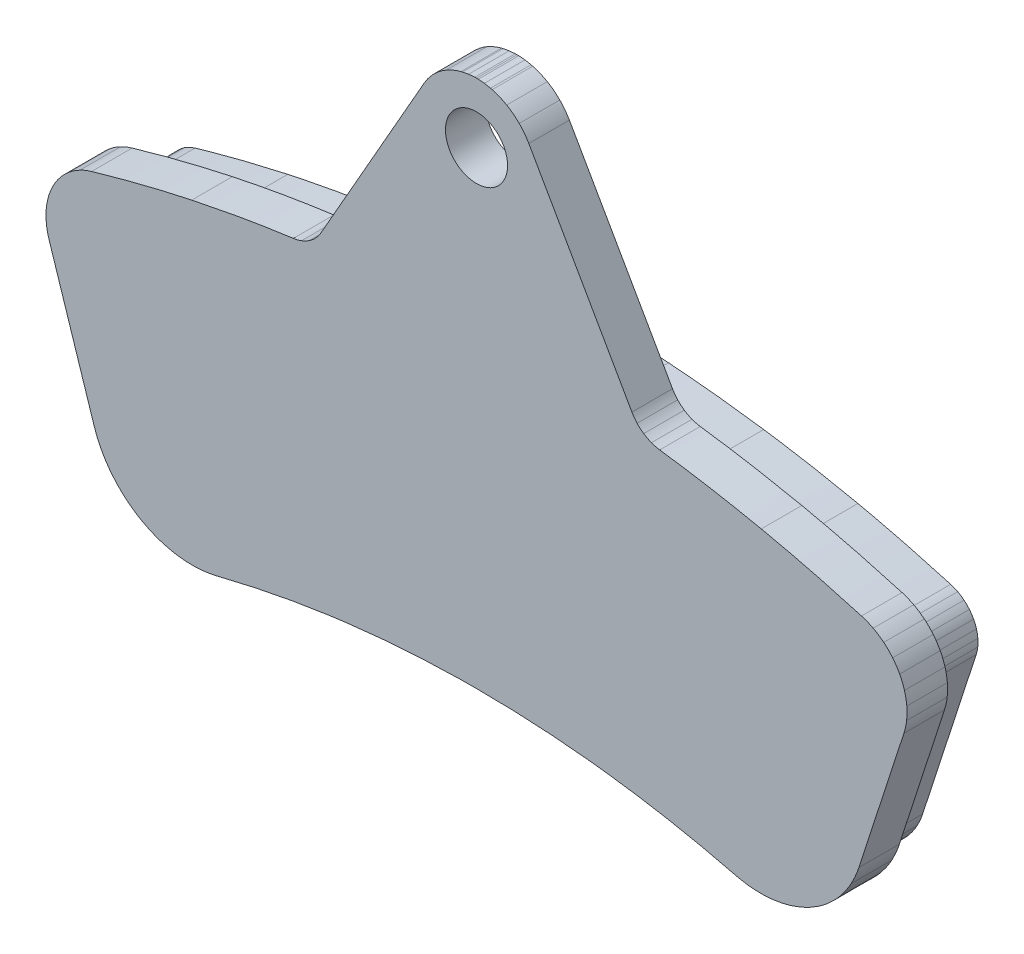
from build123d import *

# Parameters (mm, degrees)
SKETCH1_R       = 2.450000003
PAD_MOUNT_DEPTH = 3.2004
PAD_DEPTH       = 4.39928


# Read off the part's stored shape, not the designer's step: Surface-Imported1
with BuildPart() as part:
    # Sketch1 → Pad Mount (new body)
    with BuildSketch(Plane.XY):
        with BuildLine():
            Line((12.25936605, -11.934212392), (4.128007879, 2.34990451))
            add(Edge.make_bspline(
                [(4.128007879, 2.34990451), (3.999340352, 2.574099785), (3.867066243, 2.758693855), (3.769843289, 2.894372567), (3.652326571, 3.037042058), (3.593097298, 3.108948509), (3.480614764, 3.231703476), (3.404855291, 3.314381659), (3.373949892, 3.343280933)],
                knots=[0, 0, 0, 0.25, 0.25, 0.5, 0.5, 0.75, 0.75, 1, 1, 1], degree=2))
            add(Edge.make_bspline(
                [(3.373949892, 3.343280933), (3.191488806, 3.52628179), (3.015799694, 3.670091127), (2.886629827, 3.775822397), (2.736010579, 3.88301786), (2.660082133, 3.937056006), (2.519546357, 4.026281686), (2.424826493, 4.086419001), (2.387461943, 4.106270388)],
                knots=[0, 0, 0, 0.25, 0.25, 0.5, 0.5, 0.75, 0.75, 1, 1, 1], degree=2))
            add(Edge.make_bspline(
                [(2.387461943, 4.106270388), (2.163623297, 4.23545869), (1.956539516, 4.328575304), (1.804297969, 4.397031739), (1.630975245, 4.461321335), (1.543604269, 4.493729345), (1.384680302, 4.543303417), (1.277585639, 4.576710074), (1.236341357, 4.586153551)],
                knots=[0, 0, 0, 0.25, 0.25, 0.5, 0.5, 0.75, 0.75, 1, 1, 1], degree=2))
            ThreePointArc((1.236341357, 4.586153551), (1.170341889, 4.603302607), (1.104136768, 4.619639742))
            add(Edge.make_bspline(
                [(1.104136768, 4.619639742), (1.095584239, 4.621613503), (1.086562435, 4.623671516), (0.924257625, 4.660695763), (0.832434712, 4.676594864), (0.725207991, 4.695161129), (0.623571318, 4.70880675)],
                knots=[0.35283416, 0.35283416, 0.35283416, 0.373455028, 0.373455028, 0.623455028, 0.623455028, 0.770620868, 0.770620868, 0.770620868], degree=2))
            add(Edge.make_bspline(
                [(0.623571318, 4.70880675), (0.521887144, 4.722086545), (0.413524712, 4.732070465), (0.320728996, 4.740620152), (0.154381691, 4.747118918), (0.14513468, 4.747480175), (0.13636275, 4.747800627)],
                knots=[0.352835881, 0.352835881, 0.352835881, 0.5, 0.5, 0.75, 0.75, 0.770621972, 0.770621972, 0.770621972], degree=2))
            ThreePointArc((0.13636275, 4.747800627), (0.068187762, 4.749259353), (1e-09, 4.749880644))
            ThreePointArc((1e-09, 4.749880644), (-0.068187939, 4.749259351), (-0.136363104, 4.747800615))
            add(Edge.make_bspline(
                [(-0.136363104, 4.747800615), (-0.145134917, 4.747480166), (-0.154381691, 4.747118918), (-0.320728996, 4.740620152), (-0.413524712, 4.732070465), (-0.521889791, 4.722086301), (-0.623576284, 4.708806093)],
                knots=[0.352832286, 0.352832286, 0.352832286, 0.373453842, 0.373453842, 0.623453842, 0.623453842, 0.770621556, 0.770621556, 0.770621556], degree=2))
            add(Edge.make_bspline(
                [(-0.623576284, 4.708806093), (-0.72521061, 4.695160675), (-0.832434712, 4.676594864), (-0.924257625, 4.660695763), (-1.086562435, 4.623671516), (-1.095584388, 4.621613468), (-1.104137051, 4.619639676)],
                knots=[0.352837755, 0.352837755, 0.352837755, 0.5, 0.5, 0.75, 0.75, 0.77062121, 0.77062121, 0.77062121], degree=2))
            ThreePointArc((-1.104137051, 4.619639676), (-1.17034203, 4.603302572), (-1.236341357, 4.586153551))
            add(Edge.make_bspline(
                [(-1.236341357, 4.586153551), (-1.277585639, 4.576710074), (-1.384680302, 4.543303417), (-1.543604269, 4.493729345), (-1.630975245, 4.461321335), (-1.804297969, 4.397031739), (-1.956539516, 4.328575304), (-2.163623297, 4.23545869), (-2.387461943, 4.106270388)],
                knots=[0, 0, 0, 0.25, 0.25, 0.5, 0.5, 0.75, 0.75, 1, 1, 1], degree=2))
            add(Edge.make_bspline(
                [(-2.387461943, 4.106270388), (-2.424826493, 4.086419001), (-2.519546357, 4.026281686), (-2.660082133, 3.937056006), (-2.736010579, 3.88301786), (-2.886629827, 3.775822397), (-3.015799694, 3.670091127), (-3.191488806, 3.52628179), (-3.373949892, 3.343280933)],
                knots=[0, 0, 0, 0.25, 0.25, 0.5, 0.5, 0.75, 0.75, 1, 1, 1], degree=2))
            add(Edge.make_bspline(
                [(-3.373949892, 3.343280933), (-3.404855291, 3.314381659), (-3.480614764, 3.231703476), (-3.593097298, 3.108948509), (-3.652326571, 3.037042058), (-3.769843289, 2.894372567), (-3.867066243, 2.758693855), (-3.999340352, 2.574099785), (-4.128007879, 2.34990451)],
                knots=[0, 0, 0, 0.25, 0.25, 0.5, 0.5, 0.75, 0.75, 1, 1, 1], degree=2))
            Line((-4.128007879, 2.34990451), (-12.25936605, -11.934212392))
            add(Edge.make_bspline(
                [(-12.25936605, -11.934212392), (-12.271321337, -11.960179359), (-12.361174649, -12.099380332), (-12.406249196, -12.169209931), (-12.451105068, -12.229686447), (-12.561130043, -12.378026602), (-12.665840232, -12.488926906)],
                knots=[0, 0, 0, 0.5, 0.5, 0.714285714, 0.714285714, 1, 1, 1], degree=2))
            add(Edge.make_bspline(
                [(-12.665840232, -12.488926906), (-12.683394704, -12.511489174), (-12.802586447, -12.626571259), (-12.862378443, -12.684301662), (-12.919827679, -12.732974592), (-13.060742155, -12.852362087), (-13.18795556, -12.936503732)],
                knots=[0, 0, 0, 0.5, 0.5, 0.714285714, 0.714285714, 1, 1, 1], degree=2))
            add(Edge.make_bspline(
                [(-13.18795556, -12.936503732), (-13.210186677, -12.954475623), (-13.352453428, -13.039391407), (-13.423820972, -13.081989068), (-13.490844618, -13.116300669), (-13.655243988, -13.200462093), (-13.798276061, -13.253423727)],
                knots=[0, 0, 0, 0.5, 0.5, 0.714285714, 0.714285714, 1, 1, 1], degree=2))
            add(Edge.make_bspline(
                [(-13.798276061, -13.253423727), (-13.822956068, -13.265356768), (-13.977800116, -13.314849615), (-14.056049838, -13.339860595), (-14.125912582, -13.357468513), (-14.302341812, -13.401935009), (-14.44957275, -13.420858544)],
                knots=[-6.75e-07, -6.75e-07, -6.75e-07, 0.499999325, 0.499999325, 0.714285039, 0.714285039, 1, 1, 1], degree=2))
            add(Edge.make_bspline(
                [(-14.44957275, -13.420858544), (-14.454612733, -13.420009478), (-14.46009159, -13.422076708), (-14.470596867, -13.423456967), (-14.475850695, -13.424160231), (-14.491601891, -13.426281129), (-14.502099942, -13.427713047), (-14.533592635, -13.432026256), (-14.554584197, -13.434927215), (-14.617555669, -13.443654624), (-14.659531605, -13.449508945), (-14.785454675, -13.467106572), (-14.869398903, -13.478885246), (-15.037280682, -13.502460443), (-15.121220279, -13.51426787), (-15.247118291, -13.532043878), (-15.289384, -13.538022813), (-15.352326357, -13.546957784), (-15.37218359, -13.549781459), (-15.414141523, -13.555763676), (-15.437717081, -13.559134281), (-15.461314769, -13.562524777), (-15.463170105, -13.5627915), (-15.467102959, -13.563357241), (-15.467781255, -13.563454842), (-15.469747658, -13.563737875), (-15.470070703, -13.56378438), (-15.471381631, -13.563973123), (-15.47668036, -13.564736217), (-15.478646731, -13.565019477), (-15.488783212, -13.566480398), (-15.491404986, -13.566858451), (-15.500938679, -13.568233846), (-15.503560401, -13.568612255), (-15.512505619, -13.569903958), (-15.515127293, -13.570282703), (-15.523498451, -13.571492582), (-15.526120078, -13.571871647), (-15.53393169, -13.573001602), (-15.536553274, -13.57338097), (-15.543819945, -13.574432933), (-15.546441487, -13.574812587), (-15.553177912, -13.57578852), (-15.555799415, -13.576168445), (-15.562020369, -13.577070337), (-15.565952568, -13.577640608), (-15.576907558, -13.579230364), (-15.582150355, -13.57999166), (-15.591222652, -13.581309757), (-15.596465329, -13.582071876), (-15.60377567, -13.58313508), (-15.609018243, -13.583897919), (-15.614688278, -13.584723303), (-15.622552, -13.585868498), (-15.62946159, -13.586875412), (-15.639946263, -13.588404325), (-15.641772145, -13.588670706), (-15.649635496, -13.589818443), (-15.648952713, -13.589718767), (-15.65419491, -13.590484184), (-15.652614733, -13.590253429), (-15.657856899, -13.591019054), (-15.655504478, -13.590675442), (-15.66074662, -13.591441231), (-15.6577473, -13.591003044), (-15.662989423, -13.59176896), (-15.659468694, -13.59125452), (-15.664710803, -13.592020534), (-15.660794257, -13.591448192), (-15.666036355, -13.592214281), (-15.661849656, -13.591602405), (-15.667091745, -13.592368555), (-15.662760604, -13.591735522), (-15.668002686, -13.592501723), (-15.663652848, -13.591865914), (-15.668894922, -13.592632165), (-15.664652158, -13.592011963), (-15.669894225, -13.592778271), (-15.665884338, -13.592192061), (-15.671126393, -13.592958439), (-15.667475228, -13.592424614), (-15.672717271, -13.593191082), (-15.669550734, -13.592728049), (-15.67479276, -13.593494635), (-15.672234402, -13.593120467), (-15.677476406, -13.593887205), (-15.675578556, -13.593609575), (-15.680820532, -13.594376502), (-15.679554783, -13.594191289), (-15.687417698, -13.595342017), (-15.686651652, -13.595229866), (-15.697135377, -13.596765269), (-15.69850539, -13.596966005), (-15.708988919, -13.598502744), (-15.712233619, -13.598978617), (-15.727958572, -13.601286043), (-15.739025421, -13.602911897), (-15.759990971, -13.605995649), (-15.775411129, -13.608266802), (-15.796375484, -13.611358664), (-15.814037245, -13.613967145), (-15.835000336, -13.617067562), (-15.852775302, -13.619700161), (-15.873737131, -13.622809102), (-15.889570345, -13.625160509), (-15.910530979, -13.628277495), (-15.923795128, -13.630252375), (-15.944754655, -13.633376799), (-15.955970979, -13.635050718), (-16.0083672, -13.642879166), (-16.043973796, -13.648221486), (-16.106837788, -13.657692098), (-16.126102957, -13.660600522), (-16.168008401, -13.666939991), (-16.189247755, -13.670159936), (-16.252099944, -13.679708568), (-16.295725529, -13.686364358), (-16.37951251, -13.699200332), (-16.421193986, -13.705611761), (-16.546851203, -13.725016912), (-16.630518229, -13.738039715), (-16.756129715, -13.757738714), (-16.796935554, -13.764161866), (-16.880661696, -13.777388869), (-16.924398911, -13.784324044), (-17.008110035, -13.797645758), (-17.053100263, -13.80483155), (-17.11587237, -13.814893187), (-17.133347588, -13.81769885), (-17.175192237, -13.824427926), (-17.201848119, -13.82872311), (-17.243688447, -13.835479), (-17.265191593, -13.83895766), (-17.307027882, -13.845738513), (-17.324891978, -13.848639094), (-17.366724446, -13.855443484), (-17.383956549, -13.85825135), (-17.425785221, -13.865079036), (-17.444842069, -13.868195299), (-17.549403928, -13.885324572), (-17.635217359, -13.899487743), (-17.802450339, -13.927294431), (-17.885465604, -13.941198764), (-18.13621559, -13.983502763), (-18.303541222, -14.012141441), (-18.554086942, -14.055638865), (-18.637030306, -14.070140342), (-18.762251048, -14.092187147), (-18.80382421, -14.099532213), (-18.887287118, -14.114329625), (-18.931375389, -14.122173854), (-19.014820218, -14.137072876), (-19.056979102, -14.144626417), (-19.109120907, -14.154000892), (-19.118261767, -14.155645663), (-19.133903501, -14.158462492), (-19.138312085, -14.159256728), (-19.14873964, -14.161136099), (-19.155834989, -14.162415553), (-19.181903043, -14.167118606), (-19.207833767, -14.171806045), (-19.249537507, -14.179359404), (-19.272182892, -14.183468498), (-19.313881742, -14.191048798), (-19.334094781, -14.194729736), (-19.396636013, -14.20613887), (-19.433207153, -14.212832991), (-19.516577304, -14.228144369), (-19.55368801, -14.234982775), (-19.63703998, -14.250392822), (-19.67778132, -14.257950619), (-19.802781272, -14.281216643), (-19.888698828, -14.297317056), (-20.138585303, -14.344454443), (-20.30472939, -14.37620318), (-21.136944467, -14.537200406), (-21.801865173, -14.672127069), (-22.465204102, -14.81216957)],
                knots=[0, 0, 0, 0, 1.5893e-05, 1.5893e-05, 3.1787e-05, 3.1787e-05, 6.3573e-05, 6.3573e-05, 0.000127147, 0.000127147, 0.000254293, 0.000254293, 0.000508587, 0.000508587, 0.00076288, 0.00076288, 0.000890027, 0.000890027, 0.000953601, 0.000953601, 0.001017174, 0.001017174, 0.001025121, 0.001025121, 0.001029094, 0.001029094, 0.001031081, 0.001031081, 0.001033067, 0.001033067, 0.001037041, 0.001037041, 0.001041014, 0.001041014, 0.001044987, 0.001044987, 0.001048961, 0.001048961, 0.001052934, 0.001052934, 0.001056907, 0.001056907, 0.001060881, 0.001060881, 0.001064854, 0.001064854, 0.001072801, 0.001072801, 0.001080747, 0.001080747, 0.001088694, 0.001088694, 0.001096641, 0.001096641, 0.001112534, 0.001112534, 0.001128427, 0.001128427, 0.001136374, 0.001136374, 0.001144321, 0.001144321, 0.001152267, 0.001152267, 0.001160214, 0.001160214, 0.001168161, 0.001168161, 0.001176107, 0.001176107, 0.001184054, 0.001184054, 0.001192001, 0.001192001, 0.001199947, 0.001199947, 0.001207894, 0.001207894, 0.001215841, 0.001215841, 0.001223787, 0.001223787, 0.001231734, 0.001231734, 0.001239681, 0.001239681, 0.001247627, 0.001247627, 0.001255574, 0.001255574, 0.001271467, 0.001271467, 0.001287361, 0.001287361, 0.001303254, 0.001303254, 0.001335041, 0.001335041, 0.001366828, 0.001366828, 0.001398614, 0.001398614, 0.001430401, 0.001430401, 0.001462188, 0.001462188, 0.001493974, 0.001493974, 0.001525761, 0.001525761, 0.001652908, 0.001652908, 0.001716481, 0.001716481, 0.001780054, 0.001780054, 0.001907201, 0.001907201, 0.002034348, 0.002034348, 0.002288641, 0.002288641, 0.002415788, 0.002415788, 0.002542935, 0.002542935, 0.002670082, 0.002670082, 0.002733655, 0.002733655, 0.002797228, 0.002797228, 0.002860802, 0.002860802, 0.002924375, 0.002924375, 0.002987949, 0.002987949, 0.003051522, 0.003051522, 0.003305815, 0.003305815, 0.003560109, 0.003560109, 0.004068696, 0.004068696, 0.004322989, 0.004322989, 0.004450136, 0.004450136, 0.004577283, 0.004577283, 0.00470443, 0.00470443, 0.004736216, 0.004736216, 0.00475211, 0.00475211, 0.004768003, 0.004768003, 0.004831576, 0.004831576, 0.00489515, 0.00489515, 0.004958723, 0.004958723, 0.00508587, 0.00508587, 0.005213017, 0.005213017, 0.005340163, 0.005340163, 0.005594457, 0.005594457, 0.006103044, 0.006103044, 0.008137392, 0.008137392, 0.008137392, 0.008137392], degree=3))
            add(Edge.make_bspline(
                [(-22.465204102, -14.81216957), (-22.467932819, -14.81199209), (-22.801976608, -14.884791625), (-23.28899373, -14.990929267), (-23.475830393, -15.032391531), (-24.273884354, -15.209493408), (-25.14380235, -15.417678651), (-27.750005353, -16.041384574), (-30.368003375, -16.807420069)],
                knots=[0, 0, 0, 0.5, 0.5, 0.625, 0.625, 0.75, 0.75, 1, 1, 1], degree=2))
            add(Edge.make_bspline(
                [(-30.368003375, -16.807420069), (-30.395294851, -16.814617959), (-30.490293235, -16.84545993), (-30.607429645, -16.883489185), (-30.675542907, -16.908190074), (-30.986262156, -17.020870653), (-31.293206518, -17.182358994)],
                knots=[0, 0, 0, 0.25, 0.25, 0.5, 0.5, 1, 1, 1], degree=2))
            add(Edge.make_bspline(
                [(-31.293206518, -17.182358994), (-31.318524095, -17.194835155), (-31.40550191, -17.243934796), (-31.512748678, -17.304476416), (-31.57459724, -17.342216376), (-31.856738205, -17.514378644), (-32.125483347, -17.733625937)],
                knots=[0, 0, 0, 0.25, 0.25, 0.5, 0.5, 1, 1, 1], degree=2))
            add(Edge.make_bspline(
                [(-32.125483347, -17.733625937), (-32.147817787, -17.750883026), (-32.223307849, -17.816283081), (-32.316389803, -17.896923693), (-32.369508193, -17.946198294), (-32.611823829, -18.170979319), (-32.831656725, -18.439245678)],
                knots=[0, 0, 0, 0.25, 0.25, 0.5, 0.5, 1, 1, 1], degree=2))
            add(Edge.make_bspline(
                [(-32.831656725, -18.439245678), (-32.850117706, -18.460595773), (-32.911110741, -18.53968919), (-32.986317344, -18.637214213), (-33.028588095, -18.696059217), (-33.221418929, -18.964498521), (-33.383576292, -19.271089961)],
                knots=[0, 0, 0, 0.25, 0.25, 0.5, 0.5, 1, 1, 1], degree=2))
            add(Edge.make_bspline(
                [(-33.383576292, -19.271089961), (-33.397427897, -19.295681982), (-33.441492507, -19.38531582), (-33.49582575, -19.495837556), (-33.525563803, -19.561907195), (-33.661222955, -19.863303896), (-33.759240733, -20.195998759)],
                knots=[0, 0, 0, 0.25, 0.25, 0.5, 0.5, 1, 1, 1], degree=2))
            add(Edge.make_bspline(
                [(-33.759240733, -20.195998759), (-33.767930795, -20.222852381), (-33.793310448, -20.319453596), (-33.824604472, -20.438566362), (-33.840624383, -20.509226915), (-33.913704043, -20.831566369), (-33.943674854, -21.177102247)],
                knots=[0, 0, 0, 0.25, 0.25, 0.5, 0.5, 1, 1, 1], degree=2))
            add(Edge.make_bspline(
                [(-33.943674854, -21.177102247), (-33.946856957, -21.205147009), (-33.952539914, -21.304864692), (-33.959547203, -21.427820168), (-33.961210362, -21.50025484), (-33.968797367, -21.830687609), (-33.929526554, -22.175290528)],
                knots=[0, 0, 0, 0.25, 0.25, 0.5, 0.5, 1, 1, 1], degree=2))
            add(Edge.make_bspline(
                [(-33.929526554, -22.175290528), (-33.927073854, -22.203408467), (-33.912833591, -22.30226764), (-33.895274837, -22.424164548), (-33.882514945, -22.495485909), (-33.824306844, -22.820839851), (-33.717359834, -23.15077264)],
                knots=[0, 0, 0, 0.25, 0.25, 0.5, 0.5, 1, 1, 1], degree=2))
            Line((-33.717359834, -23.15077264), (-30.157868747, -34.105759847))
            add(Edge.make_bspline(
                [(-30.157868747, -34.105759847), (-30.137294808, -34.172965178), (-30.072006379, -34.35576287), (-30.00117242, -34.554087202), (-29.910375013, -34.768028674), (-29.815576212, -34.991398435), (-29.713124966, -35.198705114), (-29.650543314, -35.325337001), (-29.551214476, -35.508679211)],
                knots=[0, 0, 0, 0.25, 0.25, 0.5, 0.5, 0.75, 0.75, 1, 1, 1], degree=2))
            add(Edge.make_bspline(
                [(-29.551214476, -35.508679211), (-29.518445034, -35.570856423), (-29.42014924, -35.738234774), (-29.31350432, -35.919830041), (-29.184329381, -36.113037034), (-29.049461746, -36.314758593), (-28.910077967, -36.499270071), (-28.824936328, -36.61197766), (-28.693097928, -36.773530201)],
                knots=[0, 0, 0, 0.25, 0.25, 0.5, 0.5, 0.75, 0.75, 1, 1, 1], degree=2))
            add(Edge.make_bspline(
                [(-28.693097928, -36.773530201), (-28.649287324, -36.828489019), (-28.521446757, -36.974551904), (-28.382747578, -37.133021183), (-28.219745464, -37.29868773), (-28.049559865, -37.471655184), (-27.878153508, -37.6268718), (-27.7734511, -37.721684815), (-27.613747306, -37.85575678)],
                knots=[0, 0, 0, 0.25, 0.25, 0.5, 0.5, 0.75, 0.75, 1, 1, 1], degree=2))
            add(Edge.make_bspline(
                [(-27.613747306, -37.85575678), (-27.560438808, -37.901561221), (-27.407556822, -38.021163371), (-27.241689209, -38.150924396), (-27.050601828, -38.283214724), (-26.851093307, -38.421335031), (-26.653702437, -38.541789041), (-26.533127561, -38.615367557), (-26.351184183, -38.717236075)],
                knots=[0, 0, 0, 0.25, 0.25, 0.5, 0.5, 0.75, 0.75, 1, 1, 1], degree=2))
            add(Edge.make_bspline(
                [(-26.351184183, -38.717236075), (-26.290255683, -38.752272603), (-26.117717755, -38.841200883), (-25.930524685, -38.937682613), (-25.718083435, -39.031936565), (-25.496279921, -39.130344278), (-25.279857839, -39.211792556), (-25.147657886, -39.261544681), (-24.949884088, -39.327621303)],
                knots=[0, 0, 0, 0.25, 0.25, 0.5, 0.5, 0.75, 0.75, 1, 1, 1], degree=2))
            add(Edge.make_bspline(
                [(-24.949884088, -39.327621303), (-24.883481845, -39.350655719), (-24.697365851, -39.405777506), (-24.495441385, -39.465581272), (-24.269129706, -39.518478664), (-24.032844555, -39.573707224), (-23.805015079, -39.613280628), (-23.665846988, -39.637453774), (-23.45920965, -39.665410863)],
                knots=[0, 0, 0, 0.25, 0.25, 0.5, 0.5, 0.75, 0.75, 1, 1, 1], degree=2))
            add(Edge.make_bspline(
                [(-23.45920965, -39.665410863), (-23.389672798, -39.675631746), (-23.196534918, -39.695005309), (-22.986992169, -39.716024436), (-22.754782271, -39.725701872), (-22.512338905, -39.735805792), (-22.281127566, -39.732110301), (-22.139893698, -39.729852935), (-21.931671861, -39.718705657)],
                knots=[0, 0, 0, 0.25, 0.25, 0.5, 0.5, 0.75, 0.75, 1, 1, 1], degree=2))
            add(Edge.make_bspline(
                [(-21.931671861, -39.718705657), (-21.87371813, -39.716271866), (-21.694267105, -39.700965204), (-21.497412263, -39.684174047), (-21.29376641, -39.655685998), (-20.929397401, -39.604714363), (-20.582463405, -39.524405047)],
                knots=[0.034088392, 0.034088392, 0.034088392, 0.284088392, 0.284088392, 0.534088392, 0.534088392, 1, 1, 1], degree=2))
            Line((-20.582463405, -39.524405047), (-20.421080262, -39.485628317))
            add(Edge.make_bspline(
                [(-20.421080262, -39.485628317), (-16.898710449, -38.599322484), (-13.359133141, -38.025484579), (-12.317638269, -37.856636951), (-11.270272743, -37.714070091), (-11.047312421, -37.683720846), (-10.615904704, -37.627762986), (-10.356738316, -37.594146535), (-10.288949511, -37.586331737)],
                knots=[0, 0, 0, 0.5, 0.5, 0.75, 0.75, 0.875, 0.875, 1, 1, 1], degree=2))
            add(Edge.make_bspline(
                [(-10.288949511, -37.586331737), (-6.684211317, -37.140809978), (-3.100899335, -37.007495229), (-2.046535834, -36.968268333), (-0.989584795, -36.955845316), (-0.764583956, -36.953200738), (-0.329568747, -36.950827788), (-0.068235153, -36.949402248), (-1e-09, -36.950000006)],
                knots=[0, 0, 0, 0.5, 0.5, 0.75, 0.75, 0.875, 0.875, 1, 1, 1], degree=2))
            add(Edge.make_bspline(
                [(-1e-09, -36.950000006), (3.632165029, -36.95205272), (7.204596693, -37.261293038), (8.255758732, -37.352284753), (9.306185801, -37.470194921), (9.529797845, -37.495295315), (9.961790319, -37.546543437), (10.22130802, -37.577330535), (10.288949509, -37.586331737)],
                knots=[0, 0, 0, 0.5, 0.5, 0.75, 0.75, 0.875, 0.875, 1, 1, 1], degree=2))
            add(Edge.make_bspline(
                [(20.421080263, -39.485628317), (20.355063384, -39.46836086), (20.101317016, -39.405830364), (19.678931447, -39.301742257), (19.460116372, -39.249279454), (18.432223337, -39.002833225), (17.400284047, -38.783009752), (13.893181828, -38.035927638), (10.288949509, -37.586331737)],
                knots=[0, 0, 0, 0.125, 0.125, 0.25, 0.25, 0.5, 0.5, 1, 1, 1], degree=2))
            Line((20.421080263, -39.485628317), (20.582543243, -39.52404427))
            add(Edge.make_bspline(
                [(20.582543243, -39.52404427), (20.929448614, -39.604445779), (21.293796594, -39.655514882), (21.497430549, -39.684057386), (21.694276794, -39.700901403), (21.873719983, -39.716256252), (21.931671861, -39.718705657)],
                knots=[0.03408605, 0.03408605, 0.03408605, 0.5, 0.5, 0.75, 0.75, 1, 1, 1], degree=2))
            add(Edge.make_bspline(
                [(21.931671861, -39.718705657), (22.139893698, -39.729852935), (22.281127566, -39.732110301), (22.512338905, -39.735805792), (22.754782271, -39.725701872), (22.986992169, -39.716024436), (23.196534918, -39.695005309), (23.389672798, -39.675631746), (23.45920965, -39.665410863)],
                knots=[0, 0, 0, 0.25, 0.25, 0.5, 0.5, 0.75, 0.75, 1, 1, 1], degree=2))
            add(Edge.make_bspline(
                [(23.45920965, -39.665410863), (23.665846988, -39.637453774), (23.805015079, -39.613280628), (24.032844555, -39.573707224), (24.269129706, -39.518478664), (24.495441385, -39.465581272), (24.697365851, -39.405777506), (24.883481845, -39.350655719), (24.949884088, -39.327621303)],
                knots=[0, 0, 0, 0.25, 0.25, 0.5, 0.5, 0.75, 0.75, 1, 1, 1], degree=2))
            add(Edge.make_bspline(
                [(24.949884088, -39.327621303), (25.147657886, -39.261544681), (25.279857839, -39.211792556), (25.496279921, -39.130344278), (25.718083435, -39.031936565), (25.930524685, -38.937682613), (26.117717755, -38.841200883), (26.290255683, -38.752272603), (26.351184183, -38.717236075)],
                knots=[0, 0, 0, 0.25, 0.25, 0.5, 0.5, 0.75, 0.75, 1, 1, 1], degree=2))
            add(Edge.make_bspline(
                [(26.351184183, -38.717236075), (26.533127561, -38.615367557), (26.653702437, -38.541789041), (26.851093307, -38.421335031), (27.050601828, -38.283214724), (27.241689209, -38.150924396), (27.407556822, -38.021163371), (27.560438808, -37.901561221), (27.613747306, -37.85575678)],
                knots=[0, 0, 0, 0.25, 0.25, 0.5, 0.5, 0.75, 0.75, 1, 1, 1], degree=2))
            add(Edge.make_bspline(
                [(27.613747306, -37.85575678), (27.7734511, -37.721684815), (27.878153508, -37.6268718), (28.049559865, -37.471655184), (28.219745464, -37.29868773), (28.382747578, -37.133021183), (28.521446757, -36.974551904), (28.649287324, -36.828489019), (28.693097928, -36.773530201)],
                knots=[0, 0, 0, 0.25, 0.25, 0.5, 0.5, 0.75, 0.75, 1, 1, 1], degree=2))
            add(Edge.make_bspline(
                [(28.693097928, -36.773530201), (28.824936328, -36.61197766), (28.910077967, -36.499270071), (29.049461746, -36.314758593), (29.184329381, -36.113037034), (29.31350432, -35.919830041), (29.42014924, -35.738234774), (29.518445034, -35.570856423), (29.551214476, -35.508679211)],
                knots=[0, 0, 0, 0.25, 0.25, 0.5, 0.5, 0.75, 0.75, 1, 1, 1], degree=2))
            add(Edge.make_bspline(
                [(29.551214476, -35.508679211), (29.650543314, -35.325337001), (29.713124966, -35.198705114), (29.815576212, -34.991398435), (29.910375013, -34.768028674), (30.00117242, -34.554087202), (30.072006379, -34.35576287), (30.137294808, -34.172965178), (30.157868742, -34.105759845)],
                knots=[0, 0, 0, 0.25, 0.25, 0.5, 0.5, 0.75, 0.75, 1, 1, 1], degree=2))
            Line((30.157868742, -34.105759845), (33.717359834, -23.15077264))
            add(Edge.make_bspline(
                [(33.717359834, -23.15077264), (33.824306844, -22.820839851), (33.882514945, -22.495485909), (33.895274837, -22.424164548), (33.912833591, -22.30226764), (33.927073854, -22.203408467), (33.929526554, -22.175290528)],
                knots=[0, 0, 0, 0.5, 0.5, 0.75, 0.75, 1, 1, 1], degree=2))
            add(Edge.make_bspline(
                [(33.929526554, -22.175290528), (33.968797367, -21.830687609), (33.961210362, -21.50025484), (33.959547203, -21.427820168), (33.952539914, -21.304864692), (33.946856957, -21.205147009), (33.943674854, -21.177102247)],
                knots=[0, 0, 0, 0.5, 0.5, 0.75, 0.75, 1, 1, 1], degree=2))
            add(Edge.make_bspline(
                [(33.943674854, -21.177102247), (33.913704043, -20.831566369), (33.840624383, -20.509226915), (33.824604472, -20.438566362), (33.793310448, -20.319453596), (33.767930795, -20.222852381), (33.759240733, -20.195998759)],
                knots=[0, 0, 0, 0.5, 0.5, 0.75, 0.75, 1, 1, 1], degree=2))
            add(Edge.make_bspline(
                [(33.759240733, -20.195998759), (33.661222955, -19.863303896), (33.525563803, -19.561907195), (33.49582575, -19.495837556), (33.441492507, -19.38531582), (33.397427897, -19.295681982), (33.383576292, -19.271089961)],
                knots=[0, 0, 0, 0.5, 0.5, 0.75, 0.75, 1, 1, 1], degree=2))
            add(Edge.make_bspline(
                [(33.383576292, -19.271089961), (33.221418929, -18.964498521), (33.028588095, -18.696059217), (32.986317344, -18.637214213), (32.911110741, -18.53968919), (32.850117706, -18.460595773), (32.831656725, -18.439245678)],
                knots=[0, 0, 0, 0.5, 0.5, 0.75, 0.75, 1, 1, 1], degree=2))
            add(Edge.make_bspline(
                [(32.831656725, -18.439245678), (32.611823829, -18.170979319), (32.369508193, -17.946198294), (32.316389803, -17.896923693), (32.223307849, -17.816283081), (32.147817787, -17.750883026), (32.125483347, -17.733625937)],
                knots=[0, 0, 0, 0.5, 0.5, 0.75, 0.75, 1, 1, 1], degree=2))
            add(Edge.make_bspline(
                [(32.125483347, -17.733625937), (31.856738205, -17.514378644), (31.57459724, -17.342216376), (31.512748678, -17.304476416), (31.40550191, -17.243934796), (31.318524095, -17.194835155), (31.293206518, -17.182358994)],
                knots=[0, 0, 0, 0.5, 0.5, 0.75, 0.75, 1, 1, 1], degree=2))
            add(Edge.make_bspline(
                [(31.293206518, -17.182358994), (30.986262156, -17.020870653), (30.675542907, -16.908190074), (30.607429645, -16.883489185), (30.490293235, -16.84545993), (30.395294851, -16.814617959), (30.368003375, -16.807420069)],
                knots=[0, 0, 0, 0.5, 0.5, 0.75, 0.75, 1, 1, 1], degree=2))
            add(Edge.make_bspline(
                [(30.368003375, -16.807420069), (27.750005353, -16.041384574), (25.14380235, -15.417678651), (24.273884354, -15.209493408), (23.475830393, -15.032391531), (23.28899373, -14.990929267), (22.801976608, -14.884791625), (22.467932819, -14.81199209), (22.465204103, -14.81216957)],
                knots=[0, 0, 0, 0.25, 0.25, 0.375, 0.375, 0.5, 0.5, 1, 1, 1], degree=2))
            add(Edge.make_bspline(
                [(22.465204103, -14.81216957), (21.801735614, -14.672099717), (21.136918673, -14.537195253), (20.138260612, -14.343998832), (19.805481693, -14.281193416), (19.388628783, -14.204648436), (19.304826873, -14.189367354), (19.200566151, -14.170491589), (19.179844801, -14.166746843), (19.138135761, -14.159222827), (19.122824996, -14.156465451), (19.08111179, -14.148964565), (19.060889229, -14.145334316), (19.019171589, -14.137858128), (18.995088708, -14.133550066), (18.953366376, -14.126100105), (18.929741181, -14.121889186), (18.888014209, -14.114465262), (18.86703844, -14.110739799), (18.804441329, -14.099641373), (18.762693795, -14.092265281), (18.637473155, -14.07021795), (18.553974948, -14.055619331), (17.802337707, -13.92512787), (17.133144906, -13.815557121), (16.295430063, -13.686190305), (16.127814856, -13.660714766), (15.876310576, -13.623154535), (15.792446028, -13.61074097), (15.666644649, -13.592293568), (15.624717318, -13.586174306), (15.561804091, -13.577036517), (15.540791038, -13.573991901), (15.509331258, -13.569444858), (15.498825911, -13.567928339), (15.483095226, -13.565660326), (15.477882347, -13.564909211), (15.467394959, -13.563399041), (15.467621198, -13.563431494), (15.4518896, -13.561169825), (15.435906871, -13.55887877), (15.414929252, -13.555878237), (15.404677901, -13.554414526), (15.373209509, -13.549927469), (15.351888138, -13.546895502), (15.288945754, -13.537960753), (15.246889224, -13.532011492), (15.120991204, -13.514235612), (15.037545852, -13.502497727), (14.869664099, -13.47892244), (14.785464949, -13.467108012), (14.65954189, -13.44951038), (14.617557658, -13.443654901), (14.554586191, -13.434927491), (14.533580686, -13.432024608), (14.502087993, -13.427711416), (14.491585302, -13.426278873), (14.475834103, -13.424158008), (14.470584304, -13.423455294), (14.460079023, -13.42207508), (14.454646664, -13.420003762), (14.44957275, -13.420858544)],
                knots=[0, 0, 0, 0, 0.002034348, 0.002034348, 0.003051522, 0.003051522, 0.003305815, 0.003305815, 0.003369389, 0.003369389, 0.003432962, 0.003432962, 0.003496535, 0.003496535, 0.003560109, 0.003560109, 0.003623682, 0.003623682, 0.003687255, 0.003687255, 0.003814402, 0.003814402, 0.004068696, 0.004068696, 0.006103044, 0.006103044, 0.00661163, 0.00661163, 0.006865924, 0.006865924, 0.006993071, 0.006993071, 0.007056644, 0.007056644, 0.007088431, 0.007088431, 0.007104324, 0.007104324, 0.007120217, 0.007120217, 0.007152004, 0.007152004, 0.007183791, 0.007183791, 0.007247364, 0.007247364, 0.007374511, 0.007374511, 0.007628804, 0.007628804, 0.007883098, 0.007883098, 0.008010245, 0.008010245, 0.008073818, 0.008073818, 0.008105605, 0.008105605, 0.008121498, 0.008121498, 0.008137391, 0.008137391, 0.008137391, 0.008137391], degree=3))
            add(Edge.make_bspline(
                [(14.44957275, -13.420858544), (14.302341812, -13.401935009), (14.125912582, -13.357468513), (14.056049838, -13.339860595), (13.977800116, -13.314849615), (13.822956068, -13.265356768), (13.798276061, -13.253423727)],
                knots=[-6.75e-07, -6.75e-07, -6.75e-07, 0.285714286, 0.285714286, 0.5, 0.5, 1, 1, 1], degree=2))
            add(Edge.make_bspline(
                [(13.798276061, -13.253423727), (13.655243988, -13.200462093), (13.490844618, -13.116300669), (13.423820972, -13.081989068), (13.352453428, -13.039391407), (13.210186677, -12.954475623), (13.18795556, -12.936503732)],
                knots=[0, 0, 0, 0.285714286, 0.285714286, 0.5, 0.5, 1, 1, 1], degree=2))
            add(Edge.make_bspline(
                [(13.18795556, -12.936503732), (13.060742155, -12.852362087), (12.919827679, -12.732974592), (12.862378443, -12.684301662), (12.802586447, -12.626571258), (12.683394704, -12.511489174), (12.665840232, -12.488926906)],
                knots=[0, 0, 0, 0.285714286, 0.285714286, 0.5, 0.5, 1, 1, 1], degree=2))
            add(Edge.make_bspline(
                [(12.665840232, -12.488926906), (12.561130043, -12.378026602), (12.451105068, -12.229686447), (12.406249196, -12.169209931), (12.361174649, -12.099380332), (12.271321337, -11.960179359), (12.25936605, -11.934212392)],
                knots=[0, 0, 0, 0.285714286, 0.285714286, 0.5, 0.5, 1, 1, 1], degree=2))
        make_face()
        Circle(SKETCH1_R, mode=Mode.SUBTRACT)
    extrude(amount=PAD_MOUNT_DEPTH)

    # Sketch2 → Pad (add)
    with BuildSketch(Plane.XY):
        with BuildLine():
            Line((27.594802329, -35.521931109), (31.815246816, -22.532738668))
            add(Edge.make_bspline(
                [(31.815246816, -22.532738668), (31.910003025, -22.243172253), (31.942546846, -21.947449403)],
                knots=[0, 0, 0, 1, 1, 1], degree=2))
            add(Edge.make_bspline(
                [(31.942546846, -21.947449403), (31.977889064, -21.64483021), (31.951035826, -21.348536414)],
                knots=[0, 0, 0, 1, 1, 1], degree=2))
            add(Edge.make_bspline(
                [(31.951035826, -21.348536414), (31.925555182, -21.044927828), (31.84037536, -20.759874319)],
                knots=[0, 0, 0, 1, 1, 1], degree=2))
            add(Edge.make_bspline(
                [(31.84037536, -20.759874319), (31.755087612, -20.467379116), (31.614976691, -20.204929052)],
                knots=[0, 0, 0, 1, 1, 1], degree=2))
            add(Edge.make_bspline(
                [(31.614976691, -20.204929052), (31.473281616, -19.93520704), (31.283824948, -19.705822494)],
                knots=[0, 0, 0, 1, 1, 1], degree=2))
            add(Edge.make_bspline(
                [(31.283824948, -19.705822494), (31.091371052, -19.469625655), (30.860120913, -19.282450633)],
                knots=[0, 0, 0, 1, 1, 1], degree=2))
            add(Edge.make_bspline(
                [(30.860120913, -19.282450633), (30.624579998, -19.089194558), (30.360754823, -18.951690478)],
                knots=[0, 0, 0, 1, 1, 1], degree=2))
            add(Edge.make_bspline(
                [(30.360754823, -18.951690478), (30.091516261, -18.809078922), (29.805632915, -18.726727116)],
                knots=[0, 0, 0, 1, 1, 1], degree=2))
            add(Edge.make_bspline(
                [(29.805632915, -18.726727116), (27.240925114, -17.976183584), (24.636453584, -17.352698306), (24.030036725, -17.207527979), (23.339558312, -17.051658403), (22.693727999, -16.905867752), (22.487608166, -16.862802537)],
                knots=[0, 0, 0, 0.5, 0.5, 0.75, 0.75, 1, 1, 1], degree=2))
            add(Edge.make_bspline(
                [(22.487608166, -16.862802537), (19.875972437, -16.296763031), (17.233720067, -15.860290401), (16.618506423, -15.758663501), (15.918682793, -15.65234943), (15.264111591, -15.552909905), (15.055448722, -15.52462908)],
                knots=[0, 0, 0, 0.5, 0.5, 0.75, 0.75, 1, 1, 1], degree=2))
            add(Edge.make_bspline(
                [(15.055448722, -15.52462908), (12.41014035, -15.145966519), (9.743517782, -14.898721836), (9.122629865, -14.841154171), (8.417012977, -14.784935201), (7.75702309, -14.732351495), (7.546876236, -14.718998597)],
                knots=[0, 0, 0, 0.5, 0.5, 0.75, 0.75, 1, 1, 1], degree=2))
            add(Edge.make_bspline(
                [(7.546876236, -14.718998597), (4.88132128, -14.529634851), (2.203862828, -14.472872987), (1.580451911, -14.459656735), (0.872623062, -14.453818201), (0.210564243, -14.448357202), (0, -14.450000004)],
                knots=[0, 0, 0, 0.5, 0.5, 0.75, 0.75, 1, 1, 1], degree=2))
            add(Edge.make_bspline(
                [(0, -14.450000004), (-2.672272612, -14.450896182), (-5.34697772, -14.584905232), (-5.969747543, -14.616107473), (-6.676195804, -14.660679008), (-7.336963301, -14.702368432), (-7.546876235, -14.718998597)],
                knots=[0, 0, 0, 0.5, 0.5, 0.75, 0.75, 1, 1, 1], degree=2))
            add(Edge.make_bspline(
                [(-7.546876235, -14.718998597), (-10.212303583, -14.910150151), (-12.870679968, -15.234249952), (-13.489647878, -15.30971232), (-14.191130013, -15.404467703), (-14.847252506, -15.493095958), (-15.055448721, -15.52462908)],
                knots=[0, 0, 0, 0.5, 0.5, 0.75, 0.75, 1, 1, 1], degree=2))
            add(Edge.make_bspline(
                [(-15.055448721, -15.52462908), (-17.700502551, -15.905065829), (-20.329057835, -16.417611442), (-20.941082304, -16.536950936), (-21.634038, -16.681409246), (-22.282185371, -16.816526505), (-22.487608165, -16.862802536)],
                knots=[0, 0, 0, 0.5, 0.5, 0.75, 0.75, 1, 1, 1], degree=2))
            add(Edge.make_bspline(
                [(-22.487608165, -16.862802536), (-25.098863632, -17.430593595), (-27.684256653, -18.128983608), (-28.286231347, -18.291594519), (-28.9671435, -18.485022557), (-29.604026124, -18.665943041), (-29.805632914, -18.726727116)],
                knots=[0, 0, 0, 0.5, 0.5, 0.75, 0.75, 1, 1, 1], degree=2))
            add(Edge.make_bspline(
                [(-29.805632914, -18.726727116), (-29.932742523, -18.765463177), (-30.016389392, -18.796951225), (-30.069810163, -18.817060954), (-30.148404534, -18.84982828), (-30.207365473, -18.874410095), (-30.319691216, -18.931286298), (-30.414487383, -18.97928639), (-30.46186613, -19.007108013), (-30.507591499, -19.033958744), (-30.568333275, -19.072710907), (-30.649823812, -19.124700408), (-30.671878742, -19.140875896)],
                knots=[0, 0, 0, 0.125, 0.125, 0.25, 0.25, 0.5, 0.5, 0.7, 0.7, 0.85, 0.85, 1, 1, 1], degree=2))
            add(Edge.make_bspline(
                [(-30.671878742, -19.140875896), (-30.780326414, -19.21773091), (-30.849757655, -19.273989428), (-30.894174499, -19.309979362), (-30.958383833, -19.365848572), (-31.00657799, -19.407782809), (-31.095302872, -19.497323767), (-31.169998745, -19.572706679), (-31.206143104, -19.614053155), (-31.241066584, -19.654003036), (-31.286444556, -19.709956817), (-31.347280724, -19.784971487), (-31.363068369, -19.807259523)],
                knots=[0, 0, 0, 0.125, 0.125, 0.25, 0.25, 0.5, 0.5, 0.7, 0.7, 0.85, 0.85, 1, 1, 1], degree=2))
            add(Edge.make_bspline(
                [(-31.363068369, -19.807259523), (-31.44166609, -19.914453086), (-31.489758677, -19.989773782), (-31.520526282, -20.03796078), (-31.56378872, -20.111263193), (-31.596260498, -20.166282274), (-31.652143321, -20.279286314), (-31.699179894, -20.374401817), (-31.720401819, -20.425048513), (-31.740909113, -20.473989725), (-31.766274789, -20.541414544), (-31.800281007, -20.631806894), (-31.808213441, -20.657939297)],
                knots=[0, 0, 0, 0.125, 0.125, 0.25, 0.25, 0.5, 0.5, 0.7, 0.7, 0.85, 0.85, 1, 1, 1], degree=2))
            add(Edge.make_bspline(
                [(-31.808213441, -20.657939297), (-31.848891035, -20.784439858), (-31.870732806, -20.871105927), (-31.884681565, -20.926453272), (-31.902590575, -21.00969768), (-31.91602581, -21.072147146), (-31.933369079, -21.196844197), (-31.948007605, -21.30209431), (-31.952176672, -21.356881993), (-31.956200001, -21.409754471), (-31.959012138, -21.481752196), (-31.962784889, -21.578344048), (-31.96207725, -21.605687664)],
                knots=[0, 0, 0, 0.125, 0.125, 0.25, 0.25, 0.5, 0.5, 0.7, 0.7, 0.85, 0.85, 1, 1, 1], degree=2))
            add(Edge.make_bspline(
                [(-31.96207725, -21.605687664), (-31.960652231, -21.748686823), (-31.951522663, -21.861073594), (-31.941973315, -21.97862793), (-31.916512901, -22.124489769), (-31.878146802, -22.344287842), (-31.815246819, -22.53273866)],
                knots=[0, 0, 0, 0.285714286, 0.285714286, 0.571428571, 0.571428571, 1, 1, 1], degree=2))
            Line((-31.815246819, -22.53273866), (-27.594802328, -35.521931109))
            add(Edge.make_bspline(
                [(-27.594802328, -35.521931109), (-27.462364767, -35.924327432), (-27.297068885, -36.265405676), (-27.195832876, -36.474300173), (-27.147840894, -36.555552599)],
                knots=[0, 0, 0, 0.5, 0.5, 1, 1, 1], degree=2))
            add(Edge.make_bspline(
                [(-27.147840894, -36.555552599), (-26.942544782, -36.926114343), (-26.716426916, -37.230298166), (-26.577940286, -37.41659655), (-26.515610891, -37.487450154)],
                knots=[0, 0, 0, 0.5, 0.5, 1, 1, 1], degree=2))
            add(Edge.make_bspline(
                [(-26.515610891, -37.487450154), (-26.244688079, -37.813123818), (-25.965713532, -38.069697948), (-25.794854648, -38.226837624), (-25.720383472, -38.284796491)],
                knots=[0, 0, 0, 0.5, 0.5, 1, 1, 1], degree=2))
            add(Edge.make_bspline(
                [(-25.720383472, -38.284796491), (-25.393377548, -38.554109787), (-25.071373557, -38.754036066), (-24.874161144, -38.876481579), (-24.790171531, -38.919504033)],
                knots=[0, 0, 0, 0.5, 0.5, 1, 1, 1], degree=2))
            add(Edge.make_bspline(
                [(-24.790171531, -38.919504033), (-24.418601775, -39.12297), (-24.064911369, -39.259205755), (-23.848292517, -39.342643791), (-23.757743117, -39.369214311)],
                knots=[0, 0, 0, 0.5, 0.5, 1, 1, 1], degree=2))
            add(Edge.make_bspline(
                [(-23.757743117, -39.369214311), (-23.35469847, -39.499665652), (-22.981780884, -39.567411799), (-22.753386258, -39.608903153), (-22.659466798, -39.618085752)],
                knots=[0, 0, 0, 0.5, 0.5, 1, 1, 1], degree=2))
            add(Edge.make_bspline(
                [(-22.659466798, -39.618085752), (-22.239145132, -39.670927098), (-21.860136815, -39.667797185), (-21.628011923, -39.66588026), (-21.534030824, -39.657351473)],
                knots=[0, 0, 0, 0.5, 0.5, 1, 1, 1], degree=2))
            add(Edge.make_bspline(
                [(-21.534030824, -39.657351473), (-21.111238489, -39.630721429), (-20.739490603, -39.556825723), (-20.51181237, -39.511568052), (-20.421080262, -39.485628317)],
                knots=[0, 0, 0, 0.5, 0.5, 1, 1, 1], degree=2))
            add(Edge.make_bspline(
                [(-20.421080262, -39.485628317), (-16.898710449, -38.599322484), (-13.359133141, -38.025484579), (-12.317638269, -37.856636951), (-11.270272743, -37.714070091), (-11.047312421, -37.683720846), (-10.615904704, -37.627762986), (-10.356738316, -37.594146535), (-10.288949511, -37.586331737)],
                knots=[0, 0, 0, 0.5, 0.5, 0.75, 0.75, 0.875, 0.875, 1, 1, 1], degree=2))
            add(Edge.make_bspline(
                [(-10.288949511, -37.586331737), (-6.684211317, -37.140809978), (-3.100899335, -37.007495229), (-2.046535834, -36.968268333), (-0.989584795, -36.955845316), (-0.764583956, -36.953200738), (-0.329568747, -36.950827788), (-0.068235153, -36.949402248), (-1e-09, -36.950000006)],
                knots=[0, 0, 0, 0.5, 0.5, 0.75, 0.75, 0.875, 0.875, 1, 1, 1], degree=2))
            add(Edge.make_bspline(
                [(-1e-09, -36.950000006), (3.632165029, -36.95205272), (7.204596693, -37.261293038), (8.255758732, -37.352284753), (9.306185801, -37.470194921), (9.529797845, -37.495295315), (9.961790319, -37.546543437), (10.22130802, -37.577330535), (10.288949509, -37.586331737)],
                knots=[0, 0, 0, 0.5, 0.5, 0.75, 0.75, 0.875, 0.875, 1, 1, 1], degree=2))
            add(Edge.make_bspline(
                [(10.288949509, -37.586331737), (13.893181828, -38.035927638), (17.400284047, -38.783009752), (18.432223337, -39.002833225), (19.460116372, -39.249279454), (19.678931447, -39.301742257), (20.101317016, -39.405830364), (20.355063384, -39.46836086), (20.421080263, -39.485628317)],
                knots=[0, 0, 0, 0.5, 0.5, 0.75, 0.75, 0.875, 0.875, 1, 1, 1], degree=2))
            add(Edge.make_bspline(
                [(20.421080263, -39.485628317), (20.832236465, -39.587672699), (21.208968802, -39.62926405), (21.439699756, -39.654736809), (21.534030824, -39.657351473)],
                knots=[0, 0, 0, 0.5, 0.5, 1, 1, 1], degree=2))
            add(Edge.make_bspline(
                [(21.534030824, -39.657351473), (21.957013181, -39.680770496), (22.334881763, -39.651233647), (22.566308629, -39.633143706), (22.659466799, -39.618085752)],
                knots=[0, 0, 0, 0.5, 0.5, 1, 1, 1], degree=2))
            add(Edge.make_bspline(
                [(22.659466799, -39.618085752), (23.079375085, -39.56205444), (23.445069018, -39.462429851), (23.669039456, -39.401414447), (23.757743118, -39.369214311)],
                knots=[0, 0, 0, 0.5, 0.5, 1, 1, 1], degree=2))
            add(Edge.make_bspline(
                [(23.757743118, -39.369214311), (24.159785593, -39.235706434), (24.500422748, -39.069503554), (24.709047103, -38.96771205), (24.790171531, -38.919504033)],
                knots=[0, 0, 0, 0.5, 0.5, 1, 1, 1], degree=2))
            add(Edge.make_bspline(
                [(24.790171531, -38.919504033), (25.160185688, -38.713222594), (25.463766753, -38.486296091), (25.649695975, -38.347314208), (25.720383472, -38.284796491)],
                knots=[0, 0, 0, 0.5, 0.5, 1, 1, 1], degree=2))
            add(Edge.make_bspline(
                [(25.720383472, -38.284796491), (26.045335056, -38.013008027), (26.301165932, -37.733351722), (26.457850395, -37.562075297), (26.515610892, -37.487450154)],
                knots=[0, 0, 0, 0.5, 0.5, 1, 1, 1], degree=2))
            add(Edge.make_bspline(
                [(26.515610892, -37.487450154), (26.784053063, -37.159728762), (26.983121787, -36.837193922), (27.105042086, -36.639656392), (27.147840894, -36.555552599)],
                knots=[0, 0, 0, 0.5, 0.5, 1, 1, 1], degree=2))
            add(Edge.make_bspline(
                [(27.147840894, -36.555552599), (27.350317429, -36.183442711), (27.485611534, -35.829391025), (27.568472857, -35.612550898), (27.594802329, -35.521931109)],
                knots=[0, 0, 0, 0.5, 0.5, 1, 1, 1], degree=2))
        make_face()
    extrude(amount=-PAD_DEPTH)


solid = part.part
